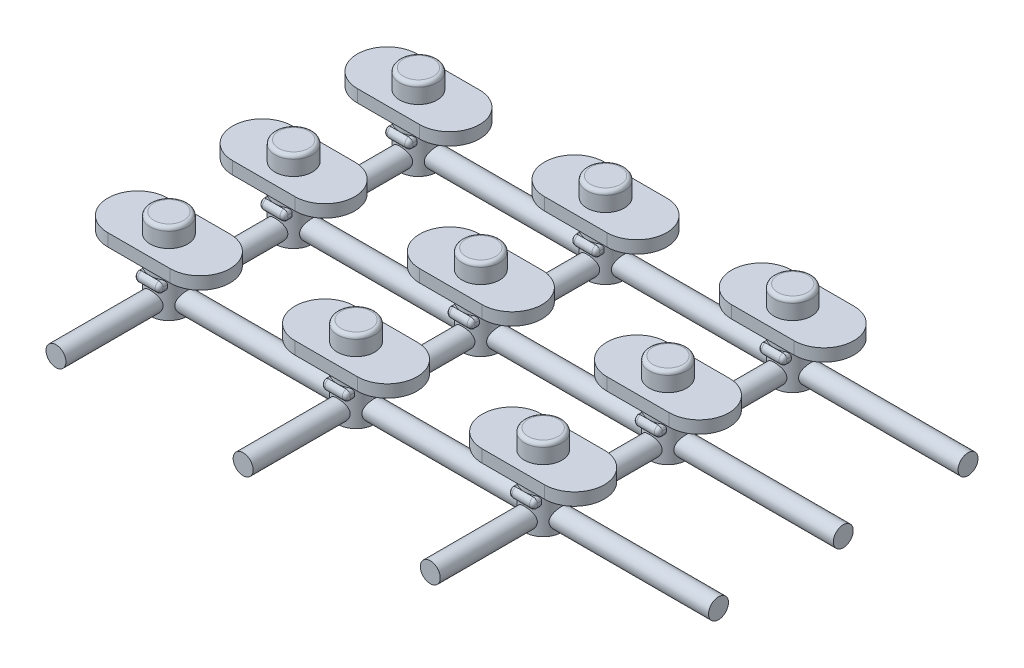
from build123d import *

# Parameters (mm, degrees)
EXTRUDE_1305_DEPTH   = 1
SKETCH_1355_R        = 1.5
EXTRUDE_1_DEPTH      = 1.5
EXTRUDE_START        = 4
SKETCH_1516_R        = 1.5
EXTRUDE_2_DEPTH      = 4
EXTRUDE_3_DEPTH      = 1.8
EXTRUDE_3_DEPTH_BACK = 1.8
SKETCH_1652_W        = 2
SKETCH_1652_H        = 0.8
CUT_EXTRUDE_START    = -2
CUT_EXTRUDE_1_DEPTH  = 2
SKETCH_6_W           = 1.7
SKETCH_6_H           = 1.7
CUT_EXTRUDE_2_DEPTH  = 2
FILLET_1_R           = 0.3
SKETCH_8_R           = 0.8
EXTRUDE_4_DEPTH      = 13.2
SKETCH_9_R           = 0.8
EXTRUDE_5_DEPTH      = 8.2


with BuildPart() as part:
    # Sketch 224 → Extrude 1305 (new body)
    with BuildSketch(Plane(origin=(0, 0, 0), x_dir=(1, 0, 0), z_dir=(0, 1, 0))):
        with BuildLine():
            Line((-2.5, -2.4), (2.5, -2.4))
            ThreePointArc((2.5, -2.4), (4.9, 0), (2.5, 2.4))
            Line((2.5, 2.4), (-2.5, 2.4))
            ThreePointArc((-2.5, 2.4), (-4.9, 0), (-2.5, -2.4))
        make_face()
    extrude(amount=EXTRUDE_1305_DEPTH)

    # Sketch 1355 → 凸台-拉伸1 (add)
    with BuildSketch(Plane(origin=(0, 1, 0), x_dir=(1, 0, 0), z_dir=(0, 1, 0))):
        with Locations(Location((0, 0, 0), (0, 0, 270))):
            Circle(SKETCH_1355_R)
    extrude(amount=EXTRUDE_1_DEPTH)

    # Sketch 1516 → 凸台-拉伸2 (add)
    with BuildSketch(Plane.XZ.offset(EXTRUDE_START)):
        with Locations(Location((0, 0, 0), (0, 0, 90))):
            Circle(SKETCH_1516_R)
    extrude(amount=-EXTRUDE_2_DEPTH)

    # Sketch 1652 → 凸台-拉伸3 (add, two sides: drawn at the far end of the back side and taken through both)
    with BuildSketch(Plane.XY.offset(-EXTRUDE_3_DEPTH_BACK)):
        with Locations((0, -1.6)):
            Rectangle(SKETCH_1652_W, SKETCH_1652_H)
    extrude(amount=EXTRUDE_3_DEPTH + EXTRUDE_3_DEPTH_BACK)

    # 切除-拉伸1: read off the stored shape, not the designer's step
    # 切除-拉伸1 outline → 切除-拉伸1 (cut)
    with BuildSketch(Plane(origin=(1, 0, 0), x_dir=(0, 0, -1), z_dir=(1, 0, 0)).offset(CUT_EXTRUDE_START)):
        with BuildLine():
            ThreePointArc((1.5, -1.2), (1.716666667, -1.35), (1.8, -1.6))
            Line((1.8, -1.6), (1.8, -1.2))
            Line((1.8, -1.2), (1.5, -1.2))
        make_face()
        with BuildLine():
            ThreePointArc((1.8, -1.6), (1.716666667, -1.85), (1.5, -2))
            Line((1.5, -2), (1.8, -2))
            Line((1.8, -2), (1.8, -1.6))
        make_face()
        with BuildLine():
            ThreePointArc((-1.5, -2), (-1.716666667, -1.85), (-1.8, -1.6))
            Line((-1.8, -1.6), (-1.8, -2))
            Line((-1.8, -2), (-1.5, -2))
        make_face()
        with BuildLine():
            ThreePointArc((-1.8, -1.6), (-1.716666667, -1.35), (-1.5, -1.2))
            Line((-1.5, -1.2), (-1.8, -1.2))
            Line((-1.8, -1.2), (-1.8, -1.6))
        make_face()
    extrude(amount=CUT_EXTRUDE_1_DEPTH, mode=Mode.SUBTRACT)

    # 草图6 → 切除-拉伸2 (cut)
    with BuildSketch(Plane.XZ.offset(4)):
        Rectangle(SKETCH_6_W, SKETCH_6_H)
    extrude(amount=-CUT_EXTRUDE_2_DEPTH, mode=Mode.SUBTRACT)

    # 圆角1
    fillet_1_edges = [part.edges().sort_by_distance(p)[0] for p in [
        (0, 2.5, -1.5),
        (1, -1.2, 1.309016994),
        (1, -2, 1.309016994),
        (-1, -2, 1.309016994),
        (-1, -1.2, 1.309016994),
        (-1, -2, -1.309016994),
        (1, -2, -1.309016994),
        (-1, -1.85, 1.716666667),
        (1, -1.85, 1.716666667),
        (-1, -1.35, -1.716666667),
        (1, -1.35, -1.716666667),
        (1, -1.2, -1.309016994),
        (-1, -1.2, -1.309016994),
    ]]
    fillet(fillet_1_edges, radius=FILLET_1_R)

    # 草图8 → 凸台-拉伸4 (add)
    with BuildSketch(Plane.ZY.offset(-0.85)):
        with Locations((0, -3)):
            Circle(SKETCH_8_R)
    extrude(amount=-EXTRUDE_4_DEPTH)

    # 草图9 → 凸台-拉伸5 (add)
    with BuildSketch(Plane(origin=(0, 0, 0.85), x_dir=(-1, 0, 0), z_dir=(0, 0, -1))):
        with Locations((0, -3)):
            Circle(SKETCH_9_R)
    extrude(amount=-EXTRUDE_5_DEPTH)


with BuildPart() as body_2:
    # 草图阵列1: read off the stored shape, not the designer's step
    # 草图阵列1: copy of part
    add(part.part.moved(Location((-15, 0, -10))))


with BuildPart() as body_3:
    # Pattern Sketch 1 2: copy of part
    add(part.part.moved(Location((15, 0, 10))))


with BuildPart() as body_4:
    # Pattern Sketch 1 3: copy of part
    add(part.part.moved(Location((-15, 0, 10))))


with BuildPart() as body_5:
    # Pattern Sketch 1 4: copy of part
    add(part.part.moved(Location((-15, 0, 0))))


with BuildPart() as body_6:
    # Pattern Sketch 1 5: copy of part
    add(part.part.moved(Location((15, 0, -10))))


with BuildPart() as body_7:
    # Pattern Sketch 1 6: copy of part
    add(part.part.moved(Location((0, 0, 10))))


with BuildPart() as body_8:
    # Pattern Sketch 1 7: copy of part
    add(part.part.moved(Location((15, 0, 0))))


with BuildPart() as body_9:
    # Pattern Sketch 1 8: copy of part
    add(part.part.moved(Location((0, 0, -10))))


with BuildPart() as part_1:
    add(part.part)

    # Combine 1: union body 9, body 8, body 7, body 6, body 5, body 4, body 3, body 2
    add(body_9.part)
    add(body_8.part)
    add(body_7.part)
    add(body_6.part)
    add(body_5.part)
    add(body_4.part)
    add(body_3.part)
    add(body_2.part)


solid = part_1.part
